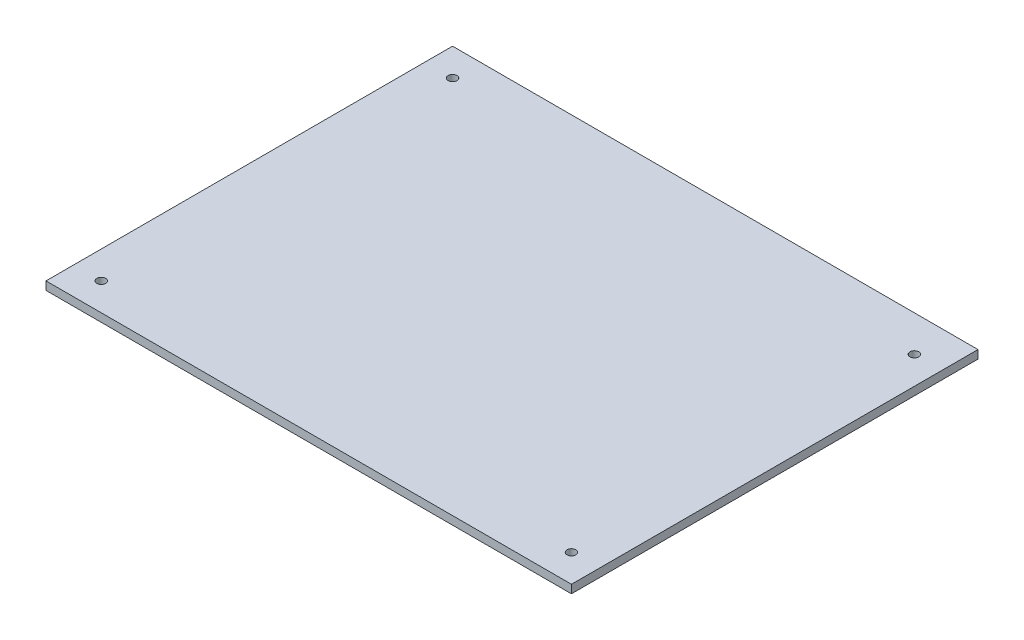
from build123d import *

# Parameters (mm, degrees)
SKETCH1_W          = 190
SKETCH1_H          = 147
SKETCH1_R          = 1.6
BASE_FLANGE1_DEPTH = 3


# Sheet-metal steps are written as plain solids
with BuildPart() as part:
    # Sketch1 → Base-Flange1 (new body)
    with BuildSketch(Plane(origin=(0, 0, 0), x_dir=(1, 0, 0), z_dir=(0, 1, 0))):
        with Locations((95, 73.5)):
            Rectangle(SKETCH1_W, SKETCH1_H)
        with Locations(Location((10, 10, 0), (0, 0, 270))):
            Circle(SKETCH1_R, mode=Mode.SUBTRACT)
        with Locations(Location((180, 10, 0), (0, 0, 270))):
            Circle(SKETCH1_R, mode=Mode.SUBTRACT)
        with Locations(Location((10, 137, 0), (0, 0, 270))):
            Circle(SKETCH1_R, mode=Mode.SUBTRACT)
        with Locations(Location((180, 134, 0), (0, 0, 270))):
            Circle(SKETCH1_R, mode=Mode.SUBTRACT)
    extrude(amount=-BASE_FLANGE1_DEPTH)


solid = part.part
